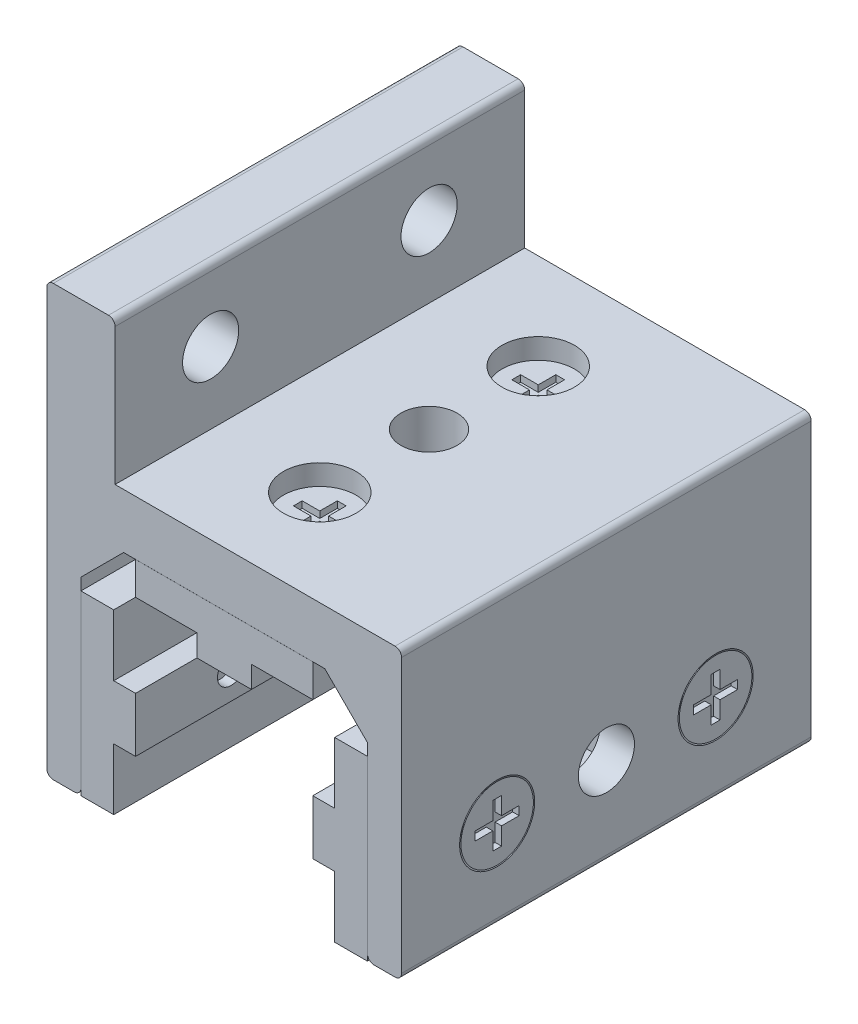
from build123d import *

# Parameters (mm, degrees)
BOSS_EXTRUDE1_DEPTH      = 23.8125
BOSS_EXTRUDE1_DEPTH_BACK = 23.8125
BOSS_EXTRUDE2_START      = -23.8125
BOSS_EXTRUDE2_DEPTH      = 47.625
CUT_EXTRUDE1_DEPTH       = 41.213151732
CUT_EXTRUDE1_DEPTH_BACK  = 41.213151732
SKETCH6_R                = 2.5527
SKETCH6_R_2              = 3.2639
SKETCH7_R                = 1.5875
SKETCH7_W                = 6.5278
SKETCH7_H                = 6.5278
CUT_EXTRUDE2_DEPTH       = 41.213151732
SKETCH8_R                = 2.5527
CUT_EXTRUDE3_DEPTH       = 6.35
SKETCH9_R                = 4.2164
CUT_EXTRUDE4_DEPTH       = 3.175
CHAMFER1_SIZE            = 1.816232475
CHAMFER1_SIZE_2          = 1.524
CUT_EXTRUDE5_DEPTH       = 0.756616
LPATTERN1_COUNT          = 2
LPATTERN1_PITCH          = 25.4
CIRPATTERN1_COUNT        = 3
CIRPATTERN1_ANGLE        = 180
FILLET1_R                = 0.762
SKETCH14_R               = 3.2639
CUT_EXTRUDE6_DEPTH       = 46.858039931


with BuildPart() as part:
    # Sketch4 → Boss-Extrude1 (new, two sides: drawn at the far end of the back side and taken through both)
    with BuildSketch(Plane.XY.offset(-BOSS_EXTRUDE1_DEPTH_BACK)):
        Polygon((-20.6248, -24.9936), (-16.65605, -24.9936), (-16.65605, -2.9797375), (-11.6951125, 1.9812), (11.6951125, 1.9812), (16.65605, -2.9797375), (16.65605, -24.9936), (20.6248, -24.9936), (20.6248, 8.3312), (-12.6873, 8.3312), (-12.6873, 24.9936), (-20.6248, 24.9936), align=None)
    extrude(amount=BOSS_EXTRUDE1_DEPTH + BOSS_EXTRUDE1_DEPTH_BACK)

    # Sketch6 → Cut-Extrude1 (cut, two sides: drawn at the far end of the back side and taken through both)
    with BuildSketch(Plane(origin=(0, 0, 0), x_dir=(0, 0, -1), z_dir=(1, 0, 0)).offset(-CUT_EXTRUDE1_DEPTH_BACK)):
        with Locations((-12.7, -14.6812)):
            Circle(SKETCH6_R)
        with Locations((0, -14.6812)):
            Circle(SKETCH6_R_2)
        with Locations((12.7, -14.6812)):
            Circle(SKETCH6_R)
        with Locations((12.7, 16.6624)):
            Circle(SKETCH6_R_2)
        with Locations((-12.7, 16.6624)):
            Circle(SKETCH6_R_2)
    extrude(amount=CUT_EXTRUDE1_DEPTH + CUT_EXTRUDE1_DEPTH_BACK, mode=Mode.SUBTRACT)

    # Sketch8 → Cut-Extrude3 (cut)
    with BuildSketch(Plane(origin=(0, 8.3312, 0), x_dir=(1, 0, 0), z_dir=(0, 1, 0))):
        with Locations(Location((0, 12.7, 0), (0, 0, 180))):
            Circle(SKETCH8_R)
        with Locations(Location((0, -12.7, 0), (0, 0, 180))):
            Circle(SKETCH8_R)
    extrude(amount=-CUT_EXTRUDE3_DEPTH, mode=Mode.SUBTRACT)

    # Sketch9 → Cut-Extrude4 (cut)
    with BuildSketch(Plane(origin=(0, 8.3312, 0), x_dir=(1, 0, 0), z_dir=(0, 1, 0))):
        with Locations(Location((0, 12.7, 0), (0, 0, 180))):
            Circle(SKETCH9_R)
        with Locations(Location((0, -12.7, 0), (0, 0, 180))):
            Circle(SKETCH9_R)
    extrude(amount=-CUT_EXTRUDE4_DEPTH, mode=Mode.SUBTRACT)

    # Chamfer1
    # the kernel refuses this chamfer: 1.816232475, 1.524 mm, written as the material it takes off along each edge
    with BuildSketch(Plane(origin=(-20.6248, -14.6812, -12.7), x_dir=(0, 0, -1), z_dir=(0, -1, 0))) as chamfer1_piece_1:
        Polygon((2.5527 + CHAMFER1_SIZE, 0), (2.5527, CHAMFER1_SIZE_2), (2.5527, 0), align=None)
    revolve(axis=Axis((-20.6248, -14.6812, -12.7), (1, 0, 0)), mode=Mode.SUBTRACT)
    with BuildSketch(Plane(origin=(-20.6248, -14.6812, 12.7), x_dir=(0, 0, -1), z_dir=(0, -1, 0))) as chamfer1_piece_2:
        Polygon((2.5527 + CHAMFER1_SIZE, 0), (2.5527, CHAMFER1_SIZE_2), (2.5527, 0), align=None)
    revolve(axis=Axis((-20.6248, -14.6812, 12.7), (1, 0, 0)), mode=Mode.SUBTRACT)
    with BuildSketch(Plane(origin=(20.6248, -14.6812, -12.7), x_dir=(0, 0, -1), z_dir=(0, 1, 0))) as chamfer1_piece_3:
        Polygon((2.5527 + CHAMFER1_SIZE, 0), (2.5527, CHAMFER1_SIZE_2), (2.5527, 0), align=None)
    revolve(axis=Axis((20.6248, -14.6812, -12.7), (-1, 0, 0)), mode=Mode.SUBTRACT)
    with BuildSketch(Plane(origin=(20.6248, -14.6812, 12.7), x_dir=(0, 0, -1), z_dir=(0, 1, 0))) as chamfer1_piece_4:
        Polygon((2.5527 + CHAMFER1_SIZE, 0), (2.5527, CHAMFER1_SIZE_2), (2.5527, 0), align=None)
    revolve(axis=Axis((20.6248, -14.6812, 12.7), (-1, 0, 0)), mode=Mode.SUBTRACT)
    with BuildSketch(Plane(origin=(0, 5.1562, 12.7), x_dir=(-1, 0, 0), z_dir=(0, 0, -1))) as chamfer1_piece_5_section:
        Polygon((2.5527, -CHAMFER1_SIZE_2), (2.5527 + CHAMFER1_SIZE, 0), (2.5527, 0), align=None)
    chamfer1_piece_5 = revolve(axis=Axis((0, 5.1562, 12.7), (0, 1, 0)), mode=Mode.PRIVATE)
    chamfer1_piece_5 = chamfer1_piece_5 & Plane(origin=(0, 4.330604361, 12.7), x_dir=(-1, 0, 0), z_dir=(0, 1, 0)) * Cylinder(4.2164, 18, mode=Mode.PRIVATE)
    add(chamfer1_piece_5, mode=Mode.SUBTRACT)
    with BuildSketch(Plane(origin=(0, 5.1562, -12.7), x_dir=(-1, 0, 0), z_dir=(0, 0, -1))) as chamfer1_piece_6_section:
        Polygon((2.5527, -CHAMFER1_SIZE_2), (2.5527 + CHAMFER1_SIZE, 0), (2.5527, 0), align=None)
    chamfer1_piece_6 = revolve(axis=Axis((0, 5.1562, -12.7), (0, 1, 0)), mode=Mode.PRIVATE)
    chamfer1_piece_6 = chamfer1_piece_6 & Plane(origin=(0, 4.330604361, -12.7), x_dir=(-1, 0, 0), z_dir=(0, 1, 0)) * Cylinder(4.2164, 18, mode=Mode.PRIVATE)
    add(chamfer1_piece_6, mode=Mode.SUBTRACT)

    # Fillet1
    fillet1_edges = [part.edges().sort_by_distance(p)[0] for p in [
        (-20.6248, 24.9936, 0),
        (-12.6873, 24.9936, 0),
        (20.6248, 8.3312, 0),
        (20.6248, -24.9936, 0),
        (16.65605, -24.9936, 0),
        (-16.65605, -24.9936, 0),
        (-20.6248, -24.9936, 0),
    ]]
    fillet(fillet1_edges, radius=FILLET1_R)

    # Sketch14 → Cut-Extrude6 (cut, through all)
    with BuildSketch(Plane(origin=(0, 8.3312, 0), x_dir=(1, 0, 0), z_dir=(0, 1, 0))):
        with Locations(Location((0, 0, 0), (0, 0, 180))):
            Circle(SKETCH14_R)
    extrude(amount=-CUT_EXTRUDE6_DEPTH, mode=Mode.SUBTRACT)


with BuildPart() as body_2:
    # Sketch5 → Boss-Extrude2 (new body)
    with BuildSketch(Plane.XY.offset(BOSS_EXTRUDE2_START)):
        Polygon((-16.65605, -4.3688), (-16.65605, -24.9936), (-12.84605, -24.9936), (-12.84605, -17.8562), (-10.30605, -17.8562), (-10.30605, -11.5062), (-12.84605, -11.5062), (-12.84605, -4.3688), align=None)
    extrude(amount=BOSS_EXTRUDE2_DEPTH)

    # Sketch7 → Cut-Extrude2 (cut, through all)
    with BuildSketch(Plane(origin=(0, 0, 0), x_dir=(0, 0, -1), z_dir=(1, 0, 0))):
        with Locations(Location((-12.7, -14.6812, 0), (0, 0, 90))):
            Circle(SKETCH7_R)
        with Locations(Location((12.7, -14.6812, 0), (0, 0, 90))):
            Circle(SKETCH7_R)
        with Locations((0, -14.6812)):
            Rectangle(SKETCH7_W, SKETCH7_H)
    extrude(amount=-CUT_EXTRUDE2_DEPTH, mode=Mode.SUBTRACT)


with BuildPart() as body_3:
    # Sketch12 → Revolve1 (revolve)
    with BuildSketch(Plane.XY.offset(12.7), mode=Mode.PRIVATE) as revolve1_sk:
        Polygon((-20.6248, -10.4648), (-20.6248, -14.6812), (-11.57605, -14.6812), (-11.57605, -12.2682), (-19.111567725, -12.2682), align=None)
    revolve(revolve1_sk.sketch.rotate(Axis((-20.6248, -14.6812, 12.7), (1, 0, 0)), 90), axis=Axis((-20.6248, -14.6812, 12.7), (1, 0, 0)))

    # Sketch13 → Cut-Extrude5 (cut)
    with BuildSketch(Plane.ZY.offset(20.6248)):
        Polygon((13.21054, -17.2339), (12.18946, -17.2339), (12.18946, -15.19174), (10.1473, -15.19174), (10.1473, -14.17066), (12.18946, -14.17066), (12.18946, -12.1285), (13.21054, -12.1285), (13.21054, -14.17066), (15.2527, -14.17066), (15.2527, -15.19174), (13.21054, -15.19174), align=None)
    extrude(amount=-CUT_EXTRUDE5_DEPTH, mode=Mode.SUBTRACT)


with BuildPart() as lpattern1_1:
    # LPattern1: pattern copy
    add(body_3.part.moved(Location(Vector(0, 0, -1) * (1 * LPATTERN1_PITCH))))


with BuildPart() as cirpattern1_1:
    # CirPattern1: pattern copy
    add(body_2.part.rotate(Axis((0, -14.6812, 0), (0, 0, -1)), 1 * CIRPATTERN1_ANGLE / (CIRPATTERN1_COUNT - 1)))


with BuildPart() as cirpattern1_2:
    # CirPattern1: pattern copy
    add(body_2.part.rotate(Axis((0, -14.6812, 0), (0, 0, -1)), 2 * CIRPATTERN1_ANGLE / (CIRPATTERN1_COUNT - 1)))


with BuildPart() as cirpattern1_3:
    # CirPattern1: pattern copy
    add(body_3.part.rotate(Axis((0, -14.6812, 0), (0, 0, -1)), 1 * CIRPATTERN1_ANGLE / (CIRPATTERN1_COUNT - 1)))


with BuildPart() as cirpattern1_4:
    # CirPattern1: pattern copy
    add(body_3.part.rotate(Axis((0, -14.6812, 0), (0, 0, -1)), 2 * CIRPATTERN1_ANGLE / (CIRPATTERN1_COUNT - 1)))


with BuildPart() as cirpattern1_5:
    # CirPattern1: pattern copy
    add(lpattern1_1.part.rotate(Axis((0, -14.6812, 0), (0, 0, -1)), 1 * CIRPATTERN1_ANGLE / (CIRPATTERN1_COUNT - 1)))


with BuildPart() as cirpattern1_6:
    # CirPattern1: pattern copy
    add(lpattern1_1.part.rotate(Axis((0, -14.6812, 0), (0, 0, -1)), 2 * CIRPATTERN1_ANGLE / (CIRPATTERN1_COUNT - 1)))


solid = Compound([part.part, body_2.part, body_3.part, lpattern1_1.part, cirpattern1_1.part, cirpattern1_2.part, cirpattern1_3.part, cirpattern1_4.part, cirpattern1_5.part, cirpattern1_6.part])
